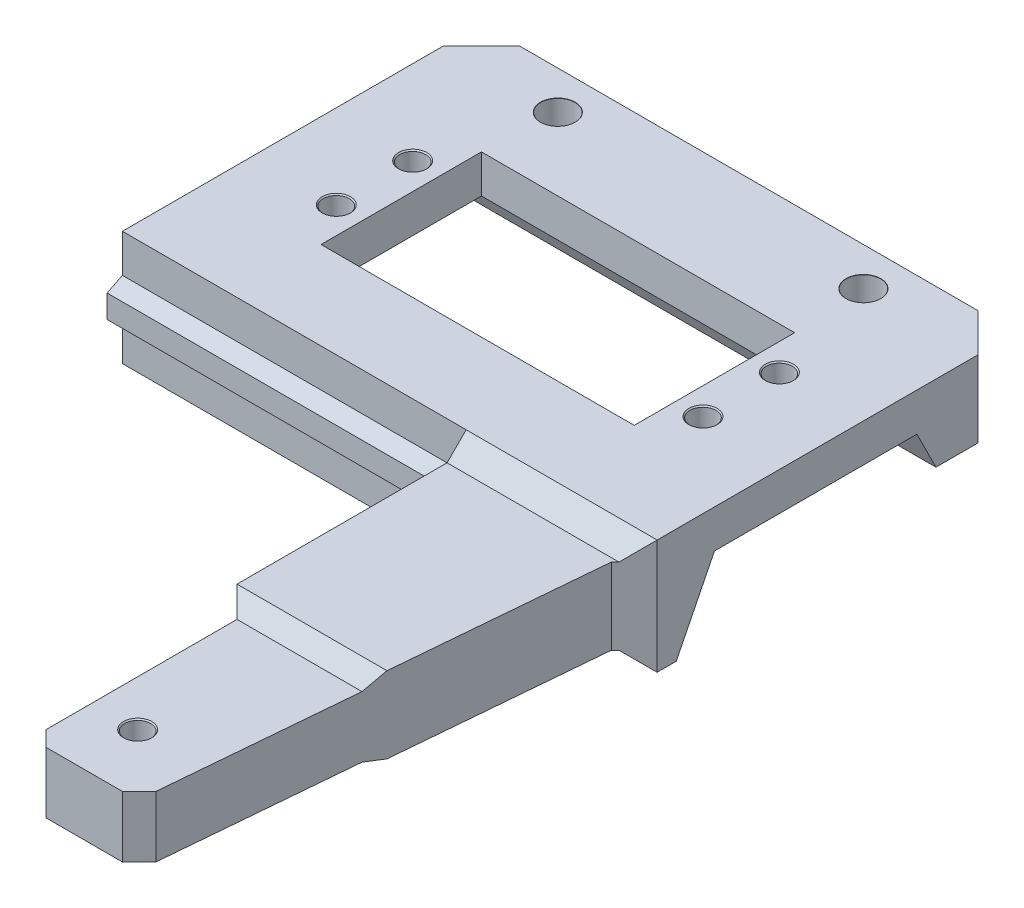
from build123d import *
from OCP.BRepFilletAPI import BRepFilletAPI_MakeChamfer

# Parameters (mm, degrees)
BODY_DEPTH                = 15
TONG_THINNING_CUT_DEPTH   = 95.731198662
LOWER_CUTOUT_DEPTH        = 109.853112036
SKETCH10_W                = 41
SKETCH10_H                = 21
SERVO_CUTOUT_DEPTH        = 91.410176418
SKETCH12_R                = 2
ROPE_TUNNEL_ROUNDS_R      = 0.5
TONG_CHAMFERS_SIZE        = 2
TONG_CHAMFERS_SIZE2       = 2.200726077
LARGER_CHAMFERS_SIZE      = 5
TONG_TIP_THINNER_DEPTH    = 95.73119871
TONG_TIP_HOLE_D           = 3.4
TONG_TIP_HOLE_CSINK_D     = 3.7
TONG_TIP_HOLE_CSINK_ANGLE = 90
GUIDING_RAIL_DEPTH        = 45
MOUTNING_FLATTENER_DEPTH  = 109.853112101


# Read off the part's stored shape, not the designer's step: guiding_screw_holes, servo_connector_holes, mouting_holes
with BuildPart() as part:
    # Sketch2 → body (new body)
    with BuildSketch(Plane(origin=(0, 0, 0), x_dir=(1, 0, 0), z_dir=(0, 1, 0))):
        Polygon((-35, 25), (35, 25), (35, -22), (32, -25), (27, -82), (13, -82), (13, -55), (10, -52), (10, -22), (-35, -22), align=None)
    extrude(amount=BODY_DEPTH)

    # Sketch3 → tong_thinning_cut (cut, through all)
    with BuildSketch(Plane.ZY.offset(-10)):
        Polygon((22, 15), (82, 15), (82, 12.5), (24.5, 12.5), align=None)
        Polygon((82, 0), (22, 0), (24.5, 2.5), (82, 2.5), align=None)
    extrude(amount=-TONG_THINNING_CUT_DEPTH, mode=Mode.SUBTRACT)

    # guiding_screw_holes outline → guiding_screw_holes (revolve, cut)
    with BuildSketch(Plane(origin=(0, 7.5, 46), x_dir=(0, 1, 0), z_dir=(0, 0, -1))):
        Polygon((1.85, 20), (0, 21.111592145), (0, 10), (2.15, 10), (1.85, 10.3), align=None)
    revolve(axis=Axis((0, 7.5, 46), (1, 0, 0)), mode=Mode.SUBTRACT)

    # guiding_screw_holes 2 outline → guiding_screw_holes 2 (revolve, cut)
    with BuildSketch(Plane(origin=(0, 7.5, 30), x_dir=(0, 1, 0), z_dir=(0, 0, -1))):
        Polygon((1.85, 20), (0, 21.111592145), (0, 10), (2.15, 10), (1.85, 10.3), align=None)
    revolve(axis=Axis((0, 7.5, 30), (1, 0, 0)), mode=Mode.SUBTRACT)

    # Sketch9 → lower_cutout (cut, through all)
    with BuildSketch(Plane(origin=(35, 0, 0), x_dir=(0, 0, -1), z_dir=(1, 0, 0))):
        Polygon((-19.5, 0), (-14.5, 10), (12, 10), (17, 0), align=None)
    extrude(amount=-LOWER_CUTOUT_DEPTH, mode=Mode.SUBTRACT)

    # Sketch10 → servo_cutout (cut, through all)
    with BuildSketch(Plane(origin=(0, 15, 0), x_dir=(1, 0, 0), z_dir=(0, 1, 0))):
        Rectangle(SKETCH10_W, SKETCH10_H)
    extrude(amount=-SERVO_CUTOUT_DEPTH, mode=Mode.SUBTRACT)

    # rope_tunnel_cutout: sweep along a path in Sketch11
    with BuildLine(Plane(origin=(0, 7.5, 0), x_dir=(1, 0, 0), z_dir=(0, 1, 0))) as rope_tunnel_cutout_path:
        Line((10, -38), (19, -38))
        ThreePointArc((19, -38), (24.656854249, -35.656854249), (27, -30))
        Line((27, -30), (27, -10))
    # Sketch12 → rope_tunnel_cutout (sweep, cut)
    with BuildSketch(Plane.ZY.offset(-10)):
        with Locations((38, 7.5)):
            Circle(SKETCH12_R)
    sweep(path=rope_tunnel_cutout_path.line, mode=Mode.SUBTRACT)

    # rope_tunnel_rounds
    rope_tunnel_rounds_edges = [part.edges().sort_by_distance(p)[0] for p in [
        (10, 7.5, 36),
        (25, 7.499978341, 15.750010829),
    ]]
    fillet(rope_tunnel_rounds_edges, radius=ROPE_TUNNEL_ROUNDS_R)

    # tong_chamfers: one chamfer whose edges measure the first distance from different faces: ONE call of the kernel's chamfer builder (chamfer() names one face for all edges)
    tong_chamfers_edges_1 = [part.edges().sort_by_distance(p)[0] for p in [
        (27, 7.5, 82),
    ]]
    tong_chamfers_side_1 = [part.faces().sort_by_distance(p)[0] for p in [
        (20, 7.5, 82),
    ]]
    tong_chamfers_edges_2 = [part.edges().sort_by_distance(p)[0] for p in [
        (13, 7.5, 82),
    ]]
    tong_chamfers = BRepFilletAPI_MakeChamfer(part.part.solid().wrapped)
    for e in tong_chamfers_edges_1:
        tong_chamfers.Add(TONG_CHAMFERS_SIZE, TONG_CHAMFERS_SIZE2, e.wrapped, tong_chamfers_side_1[0].wrapped)  # the first distance lies on this face
    for e in tong_chamfers_edges_2:
        tong_chamfers.Add(TONG_CHAMFERS_SIZE, e.wrapped)
    add(Compound.cast(tong_chamfers.Shape()), mode=Mode.REPLACE)

    # servo_connector_holes outline → servo_connector_holes (revolve, cut)
    with BuildSketch(Plane(origin=(24, 0, 5), x_dir=(1, 0, 0), z_dir=(0, 0, 1))):
        Polygon((0, 10), (1.7, 10), (1.7, 14.85), (1.85, 15), (0, 15), align=None)
    revolve(axis=Axis((24, 0, 5), (0, 1, 0)), mode=Mode.SUBTRACT)

    # servo_connector_holes 2 outline → servo_connector_holes 2 (revolve, cut)
    with BuildSketch(Plane(origin=(24, 0, -5), x_dir=(1, 0, 0), z_dir=(0, 0, 1))):
        Polygon((0, 10), (1.7, 10), (1.7, 14.85), (1.85, 15), (0, 15), align=None)
    revolve(axis=Axis((24, 0, -5), (0, 1, 0)), mode=Mode.SUBTRACT)

    # servo_connector_holes 3 outline → servo_connector_holes 3 (revolve, cut)
    with BuildSketch(Plane(origin=(-24, 0, 5), x_dir=(1, 0, 0), z_dir=(0, 0, 1))):
        Polygon((0, 10), (1.7, 10), (1.7, 14.85), (1.85, 15), (0, 15), align=None)
    revolve(axis=Axis((-24, 0, 5), (0, 1, 0)), mode=Mode.SUBTRACT)

    # servo_connector_holes 4 outline → servo_connector_holes 4 (revolve, cut)
    with BuildSketch(Plane(origin=(-24, 0, -5), x_dir=(1, 0, 0), z_dir=(0, 0, 1))):
        Polygon((0, 10), (1.7, 10), (1.7, 14.85), (1.85, 15), (0, 15), align=None)
    revolve(axis=Axis((-24, 0, -5), (0, 1, 0)), mode=Mode.SUBTRACT)

    # larger_chamfers
    larger_chamfers_edges = [part.edges().sort_by_distance(p)[0] for p in [
        (-35, 7.5, -25),
        (35, 7.5, -25),
    ]]
    chamfer(larger_chamfers_edges, length=LARGER_CHAMFERS_SIZE)

    # Sketch16 → tong_tip_thinner (cut, through all)
    with BuildSketch(Plane.ZY.offset(-10)):
        Polygon((52, 12.5), (55, 11.5), (82, 11.5), (82, 12.5), align=None)
        Polygon((52, 2.5), (55, 3.5), (82, 3.5), (82, 2.5), align=None)
    extrude(amount=-TONG_TIP_THINNER_DEPTH, mode=Mode.SUBTRACT)

    # tong_tip_hole (through all)
    with Locations(Plane(origin=(0, 11.5, 0), x_dir=(1, 0, 0), z_dir=(0, 1, 0))):
        with Locations((19, -74)):
            CounterSinkHole(TONG_TIP_HOLE_D / 2, TONG_TIP_HOLE_CSINK_D / 2, counter_sink_angle=TONG_TIP_HOLE_CSINK_ANGLE)

    # Sketch18 → guiding_rail (add)
    with BuildSketch(Plane.ZY.offset(-10)):
        Polygon((22, 10), (22, 5), (24, 6), (24, 9), align=None)
    extrude(amount=GUIDING_RAIL_DEPTH)

    # Sketch19 → moutning_flattener (cut, through all)
    with BuildSketch(Plane.ZY.offset(35)):
        Polygon((-14.5, 5), (-25, 5), (-25, 0), (-17, 0), align=None)
    extrude(amount=-MOUTNING_FLATTENER_DEPTH, mode=Mode.SUBTRACT)

    # mouting_holes outline → mouting_holes (revolve, cut)
    with BuildSketch(Plane(origin=(20, 0, -20), x_dir=(1, 0, 0), z_dir=(0, 0, 1))):
        Polygon((0, 5), (2.25, 5), (2.25, 14.975), (2.275, 15), (0, 15), align=None)
    revolve(axis=Axis((20, 0, -20), (0, 1, 0)), mode=Mode.SUBTRACT)

    # mouting_holes 2 outline → mouting_holes 2 (revolve, cut)
    with BuildSketch(Plane(origin=(-20, 0, -20), x_dir=(1, 0, 0), z_dir=(0, 0, 1))):
        Polygon((0, 5), (2.25, 5), (2.25, 14.975), (2.275, 15), (0, 15), align=None)
    revolve(axis=Axis((-20, 0, -20), (0, 1, 0)), mode=Mode.SUBTRACT)


solid = part.part
